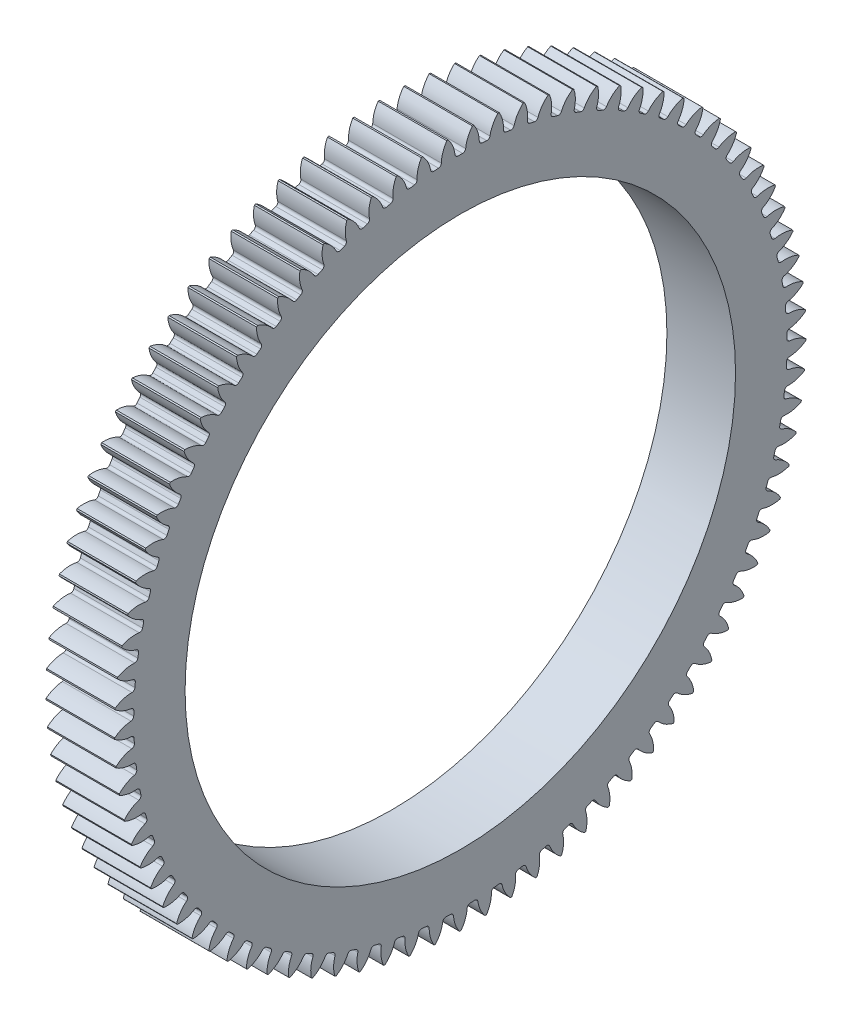
from build123d import *

# Parameters (mm, degrees)
SKETCH1_R                = 47.85
SKETCH1_R_2              = 38.1
BOSS_EXTRUDE2_DEPTH      = 9.5
CUT_EXTRUDE1_DEPTH       = 69.333703251
FILLET1_R                = 0.418
CIRPATTERN2_COUNT        = 85
FILLET1_OF_CIRPATTERN2_R = 0.418


with BuildPart() as part:
    # Sketch1 → Boss-Extrude2 (new body)
    with BuildSketch(Plane(origin=(0, 0, 0), x_dir=(0, 0, -1), z_dir=(1, 0, 0))):
        Circle(SKETCH1_R)
        Circle(SKETCH1_R_2, mode=Mode.SUBTRACT)
    extrude(amount=BOSS_EXTRUDE2_DEPTH)

    # Sketch3 → Cut-Extrude1 (cut, through all)
    with BuildSketch(Plane(origin=(9.5, 0, 0), x_dir=(0, 0, -1), z_dir=(1, 0, 0))):
        with BuildLine():
            ThreePointArc((0.716574324, 45.204320825), (0, 45.21), (-0.716574324, 45.204320825))
            ThreePointArc((-0.716574324, 45.204320825), (-0.972740961, 46.592680521), (-1.668926343, 47.820886492))
            ThreePointArc((-1.668926343, 47.820886492), (0, 47.85), (1.668926343, 47.820886492))
            ThreePointArc((1.668926343, 47.820886492), (0.972740961, 46.592680521), (0.716574324, 45.204320825))
        make_face()
    cut_extrude1 = extrude(amount=-CUT_EXTRUDE1_DEPTH, mode=Mode.SUBTRACT)

    # Fillet1
    fillet1_edges = [part.edges().sort_by_distance(p)[0] for p in [
        (4.75, 45.204320825, -0.716574324),
        (4.75, 45.204320825, 0.716574324),
    ]]
    fillet(fillet1_edges, radius=FILLET1_R)

    # CirPattern2: Cut-Extrude1 ×85 about axis
    cirpattern2_axis = Axis((9.5, 0, 0), (1, 0, 0))
    for i in range(1, CIRPATTERN2_COUNT):
        add(cut_extrude1.rotate(cirpattern2_axis, i * 360 / CIRPATTERN2_COUNT), mode=Mode.SUBTRACT)

    # Fillet1 of CirPattern2
    fillet1_of_cirpattern2_edges = [part.edges().sort_by_distance(p)[0] for p in [
        (4.75, 45.133796487, 2.623835862),
        (4.75, 45.027954838, 4.05307083),
        (4.75, 44.816767005, 5.949915566),
        (4.75, 44.605661775, 7.367430868),
        (4.75, 44.254963882, 9.243498895),
        (4.75, 43.939748056, 10.641552553),
        (4.75, 43.451455493, 12.486597438),
        (4.75, 43.033850671, 13.857553769),
        (4.75, 42.410630321, 15.661498516),
        (4.75, 41.892917315, 16.997869831),
        (4.75, 41.138172994, 18.75086192),
        (4.75, 40.523179373, 20.045349423),
        (4.75, 39.641033231, 21.737814618),
        (4.75, 38.932117877, 22.983348267),
        (4.75, 37.927387891, 24.606042912),
        (4.75, 37.128422654, 25.795820033),
        (4.75, 36.006596311, 27.339881531),
        (4.75, 35.121944862, 28.467403976),
        (4.75, 33.889149187, 29.924399198),
        (4.75, 32.923643186, 30.983508829),
        (4.75, 31.586611283, 32.345480174),
        (4.75, 30.545523988, 33.330392502),
        (4.75, 29.111558261, 34.589901353),
        (4.75, 28.00057573, 35.495237128),
        (4.75, 26.477508003, 36.645404486),
        (4.75, 25.302698037, 37.466219078),
        (4.75, 23.698846777, 38.500763128),
        (4.75, 22.466625782, 39.232573532),
        (4.75, 20.790750669, 40.145843952),
        (4.75, 19.507848608, 40.784653274),
        (4.75, 17.76910269, 41.571662098),
        (4.75, 16.442526329, 42.113981383),
        (4.75, 14.650406035, 42.770430241),
        (4.75, 13.287400674, 43.213297529),
        (4.75, 11.451693941, 43.735601126),
        (4.75, 10.059703843, 44.076597629),
        (4.75, 8.190436667, 44.461903324),
        (4.75, 6.777064399, 44.699166638),
        (4.75, 4.884446068, 44.945370024),
        (4.75, 3.457410979, 45.077604299),
        (4.75, 1.551778318, 45.183360699),
        (4.75, 0.118874379, 45.209843717),
        (4.75, -1.789364707, 45.174575526),
        (4.75, -3.220311472, 45.095162646),
        (4.75, -5.120734843, 44.919062487),
        (4.75, -6.541909098, 44.734187434),
        (4.75, -8.4241373, 44.418217105),
        (4.75, -9.827777085, 44.128889603),
        (4.75, -11.681530041, 43.674774824),
        (4.75, -13.059969161, 43.282575079),
        (4.75, -14.875122315, 42.692796068),
        (4.75, -16.220832215, 42.19986614),
        (4.75, -17.98747183, 41.477644065),
        (4.75, -19.293102709, 40.886676166),
        (4.75, -21.001580011, 40.035955553),
        (4.75, -22.260000965, 39.350177344),
        (4.75, -23.900984845, 38.375604535),
        (4.75, -25.105322815, 37.5987615),
        (4.75, -26.669850788, 36.505659273),
        (4.75, -27.813528098, 35.641994258),
        (4.75, -29.293055254, 34.436332759),
        (4.75, -30.369825536, 33.490562804),
        (4.75, -31.75627121, 32.178926937),
        (4.75, -32.760253518, 31.156217509),
        (4.75, -34.046045425, 29.745770975),
        (4.75, -34.971756355, 28.651707758),
        (4.75, -36.149871946, 27.150153927),
        (4.75, -36.992255586, 25.990712315),
        (4.75, -38.056260403, 24.406252153),
        (4.75, -38.810715946, 23.187764614),
        (4.75, -39.754798762, 21.529051893),
        (4.75, -40.417205633, 20.258173383),
        (4.75, -41.236210196, 18.534267417),
        (4.75, -41.802950558, 17.217939035),
        (4.75, -42.492403749, 15.4382552),
        (4.75, -42.960382264, 14.083666274),
        (4.75, -43.516518528, 12.257924586),
        (4.75, -43.883179259, 10.872473412),
        (4.75, -44.302961174, 9.01064544),
        (4.75, -44.566301547, 7.60189887),
        (4.75, -44.847436408, 5.714153272),
        (4.75, -45.00601815, 4.289805393),
        (4.75, -45.146970497, 2.38645238),
        (4.75, -45.199927488, 0.954282486),
        (4.75, -45.199927488, -0.954282486),
        (4.75, -45.146970497, -2.38645238),
        (4.75, -45.00601815, -4.289805393),
        (4.75, -44.847436408, -5.714153272),
        (4.75, -44.566301547, -7.60189887),
        (4.75, -44.302961174, -9.01064544),
        (4.75, -43.883179259, -10.872473412),
        (4.75, -43.516518528, -12.257924586),
        (4.75, -42.960382264, -14.083666274),
        (4.75, -42.492403749, -15.4382552),
        (4.75, -41.802950558, -17.217939035),
        (4.75, -41.236210196, -18.534267417),
        (4.75, -40.417205633, -20.258173383),
        (4.75, -39.754798762, -21.529051893),
        (4.75, -38.810715946, -23.187764614),
        (4.75, -38.056260403, -24.406252153),
        (4.75, -36.992255586, -25.990712315),
        (4.75, -36.149871946, -27.150153927),
        (4.75, -34.971756355, -28.651707758),
        (4.75, -34.046045425, -29.745770975),
        (4.75, -32.760253518, -31.156217509),
        (4.75, -31.75627121, -32.178926937),
        (4.75, -30.369825536, -33.490562804),
        (4.75, -29.293055254, -34.436332759),
        (4.75, -27.813528098, -35.641994258),
        (4.75, -26.669850788, -36.505659273),
        (4.75, -25.105322815, -37.5987615),
        (4.75, -23.900984845, -38.375604535),
        (4.75, -22.260000965, -39.350177344),
        (4.75, -21.001580011, -40.035955553),
        (4.75, -19.293102709, -40.886676166),
        (4.75, -17.98747183, -41.477644065),
        (4.75, -16.220832215, -42.19986614),
        (4.75, -14.875122315, -42.692796068),
        (4.75, -13.059969161, -43.282575079),
        (4.75, -11.681530041, -43.674774824),
        (4.75, -9.827777085, -44.128889603),
        (4.75, -8.4241373, -44.418217105),
        (4.75, -6.541909098, -44.734187434),
        (4.75, -5.120734843, -44.919062487),
        (4.75, -3.220311472, -45.095162646),
        (4.75, -1.789364707, -45.174575526),
        (4.75, 0.118874379, -45.209843717),
        (4.75, 1.551778318, -45.183360699),
        (4.75, 3.457410979, -45.077604299),
        (4.75, 4.884446068, -44.945370024),
        (4.75, 6.777064399, -44.699166638),
        (4.75, 8.190436667, -44.461903324),
        (4.75, 10.059703843, -44.076597629),
        (4.75, 11.451693941, -43.735601126),
        (4.75, 13.287400674, -43.213297529),
        (4.75, 14.650406035, -42.770430241),
        (4.75, 16.442526329, -42.113981383),
        (4.75, 17.76910269, -41.571662098),
        (4.75, 19.507848608, -40.784653274),
        (4.75, 20.790750669, -40.145843952),
        (4.75, 22.466625782, -39.232573532),
        (4.75, 23.698846777, -38.500763128),
        (4.75, 25.302698037, -37.466219078),
        (4.75, 26.477508003, -36.645404486),
        (4.75, 28.00057573, -35.495237128),
        (4.75, 29.111558261, -34.589901353),
        (4.75, 30.545523988, -33.330392502),
        (4.75, 31.586611283, -32.345480174),
        (4.75, 32.923643186, -30.983508829),
        (4.75, 33.889149187, -29.924399198),
        (4.75, 35.121944862, -28.467403976),
        (4.75, 36.006596311, -27.339881531),
        (4.75, 37.128422654, -25.795820033),
        (4.75, 37.927387891, -24.606042912),
        (4.75, 38.932117877, -22.983348267),
        (4.75, 39.641033231, -21.737814618),
        (4.75, 40.523179373, -20.045349423),
        (4.75, 41.138172994, -18.75086192),
        (4.75, 41.892917315, -16.997869831),
        (4.75, 42.410630321, -15.661498516),
        (4.75, 43.033850671, -13.857553769),
        (4.75, 43.451455493, -12.486597438),
        (4.75, 43.939748056, -10.641552553),
        (4.75, 44.254963882, -9.243498895),
        (4.75, 44.605661775, -7.367430868),
        (4.75, 44.816767005, -5.949915566),
        (4.75, 45.027954838, -4.05307083),
        (4.75, 45.133796487, -2.623835862),
    ]]
    fillet(fillet1_of_cirpattern2_edges, radius=FILLET1_OF_CIRPATTERN2_R)


solid = part.part
